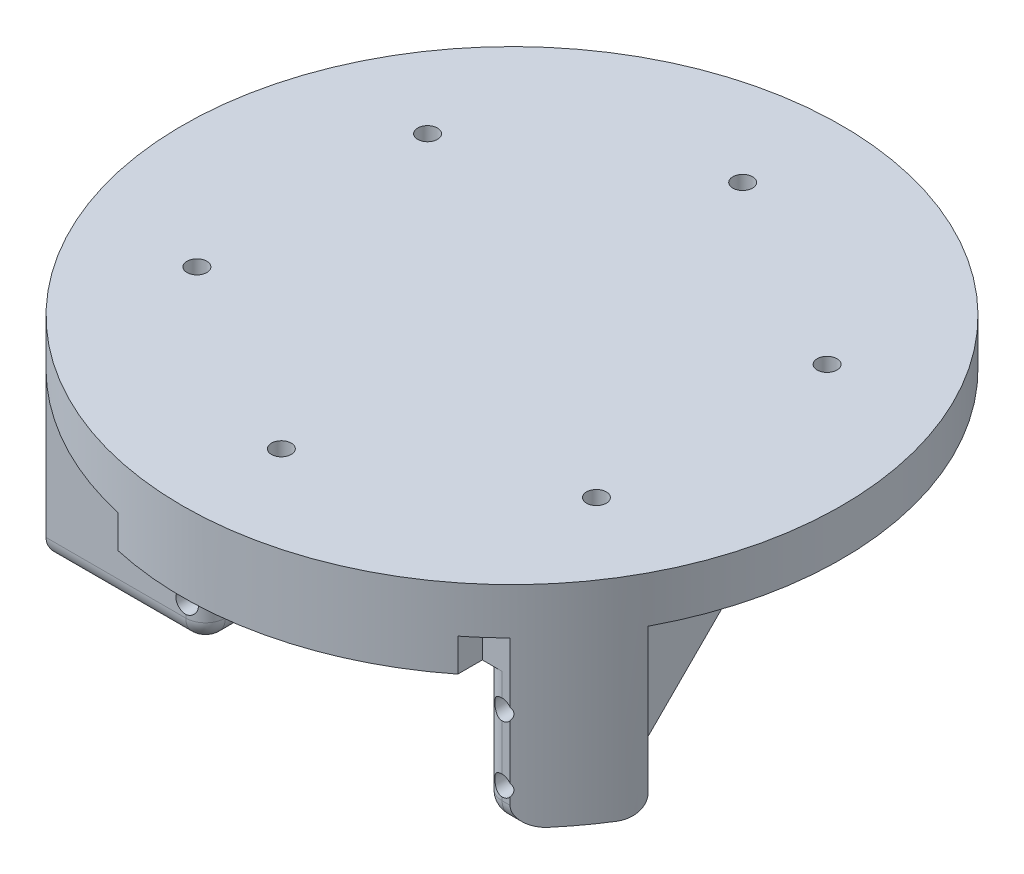
from build123d import *
from build123d.topology import SkipClean

# Parameters (mm, degrees)
SKETCH1_R            = 11.11
BOSS_EXTRUDE1_DEPTH  = 8
SKETCH2_R            = 50
SKETCH2_R_2          = 1.5
BOSS_EXTRUDE2_DEPTH  = 7
SKETCH13_R           = 22.569710477
CUT_EXTRUDE10_DEPTH  = 8
SKETCH3_R            = 4
CUT_EXTRUDE1_DEPTH   = 3
BOSS_EXTRUDE4_START  = 5
BOSS_EXTRUDE4_DEPTH  = 5
BOSS_EXTRUDE7_START  = 30
SKETCH5_6_R          = 4
BOSS_EXTRUDE7_DEPTH  = 30
SKETCH9_R            = 11.11
SKETCH9_R_2          = 4.25
CUT_EXTRUDE4_DEPTH   = 8
SKETCH9_2_R          = 4.25
CUT_EXTRUDE5_DEPTH   = 89.791891522
CUT_EXTRUDE6_START   = 30
SKETCH11_R           = 11
CUT_EXTRUDE6_DEPTH   = 9
CUT_EXTRUDE9_DEPTH   = 89.791891546
BOSS_EXTRUDE8_START  = 25
BOSS_EXTRUDE8_DEPTH  = 25
SKETCH14_3_W         = 6.5
SKETCH14_3_H         = 13.5
BOSS_EXTRUDE9_DEPTH  = 14.5
CHAMFER1_START       = 1
CHAMFER1_OUTLINE_W   = 6.5
CHAMFER1_OUTLINE_H   = 19.091883092
CHAMFER1_OUTLINE_W_2 = 9
CHAMFER1_DEPTH       = 11.02081528
SKETCH15_R           = 1.5
CUT_EXTRUDE11_DEPTH  = 21
FILLET1_START        = -18
FILLET1_DEPTH        = 21
FILLET2_R            = 3


with BuildPart() as part:
    # Sketch1 → Boss-Extrude1 (new body)
    with BuildSketch(Plane(origin=(0, 0, 0), x_dir=(1, 0, 0), z_dir=(0, 1, 0))):
        with BuildLine():
            Line((-0.88, 15.975781671), (-0.5, 17.975781671))
            Line((-0.5, 17.975781671), (0.5, 17.975781671))
            Line((0.5, 17.975781671), (0.88, 15.975781671))
            ThreePointArc((0.88, 15.975781671), (1.394491884, 15.939115169), (1.907534551, 15.885884046))
            Line((1.907534551, 15.885884046), (2.629057853, 17.789513245))
            Line((2.629057853, 17.789513245), (3.613865606, 17.615865067))
            Line((3.613865606, 17.615865067), (3.640796197, 15.580263254))
            ThreePointArc((3.640796197, 15.580263254), (4.141104722, 15.454813221), (4.637109631, 15.313301874))
            Line((4.637109631, 15.313301874), (5.678233113, 17.062719461))
            Line((5.678233113, 17.062719461), (6.617925734, 16.720699317))
            Line((6.617925734, 16.720699317), (6.290968643, 14.711346421))
            ThreePointArc((6.290968643, 14.711346421), (6.761892188, 14.500924593), (7.22578848, 14.275432772))
            Line((7.22578848, 14.275432772), (8.554878134, 15.81748358))
            Line((8.554878134, 15.81748358), (9.420903537, 15.31748358))
            Line((9.420903537, 15.31748358), (8.749993191, 13.395432772))
            ThreePointArc((8.749993191, 13.395432772), (9.177222982, 13.106432709), (9.594915403, 12.80381187))
            Line((9.594915403, 12.80381187), (11.171587511, 14.091641465))
            Line((11.171587511, 14.091641465), (11.937631954, 13.448853855))
            Line((11.937631954, 13.448853855), (10.943153623, 11.672505677))
            ThreePointArc((10.943153623, 11.672505677), (11.313708499, 11.313708499), (11.672505677, 10.943153623))
            Line((11.672505677, 10.943153623), (13.448853855, 11.937631954))
            Line((13.448853855, 11.937631954), (14.091641465, 11.171587511))
            Line((14.091641465, 11.171587511), (12.80381187, 9.594915403))
            ThreePointArc((12.80381187, 9.594915403), (13.106432709, 9.177222982), (13.395432772, 8.749993191))
            Line((13.395432772, 8.749993191), (15.31748358, 9.420903537))
            Line((15.31748358, 9.420903537), (15.81748358, 8.554878134))
            Line((15.81748358, 8.554878134), (14.275432772, 7.22578848))
            ThreePointArc((14.275432772, 7.22578848), (14.500924593, 6.761892188), (14.711346421, 6.290968643))
            Line((14.711346421, 6.290968643), (16.720699317, 6.617925734))
            Line((16.720699317, 6.617925734), (17.062719461, 5.678233113))
            Line((17.062719461, 5.678233113), (15.313301874, 4.637109631))
            ThreePointArc((15.313301874, 4.637109631), (15.454813221, 4.141104722), (15.580263254, 3.640796197))
            Line((15.580263254, 3.640796197), (17.615865067, 3.613865606))
            Line((17.615865067, 3.613865606), (17.789513245, 2.629057853))
            Line((17.789513245, 2.629057853), (15.885884046, 1.907534551))
            ThreePointArc((15.885884046, 1.907534551), (15.939115169, 1.394491884), (15.975781671, 0.88))
            Line((15.975781671, 0.88), (17.975781671, 0.5))
            Line((17.975781671, 0.5), (17.975781671, -0.5))
            Line((17.975781671, -0.5), (15.975781671, -0.88))
            ThreePointArc((15.975781671, -0.88), (15.939115169, -1.394491884), (15.885884046, -1.907534551))
            Line((15.885884046, -1.907534551), (17.789513245, -2.629057853))
            Line((17.789513245, -2.629057853), (17.615865067, -3.613865606))
            Line((17.615865067, -3.613865606), (15.580263254, -3.640796197))
            ThreePointArc((15.580263254, -3.640796197), (15.454813221, -4.141104722), (15.313301874, -4.637109631))
            Line((15.313301874, -4.637109631), (17.062719461, -5.678233113))
            Line((17.062719461, -5.678233113), (16.720699317, -6.617925734))
            Line((16.720699317, -6.617925734), (14.711346421, -6.290968643))
            ThreePointArc((14.711346421, -6.290968643), (14.500924593, -6.761892188), (14.275432772, -7.22578848))
            Line((14.275432772, -7.22578848), (15.81748358, -8.554878134))
            Line((15.81748358, -8.554878134), (15.31748358, -9.420903537))
            Line((15.31748358, -9.420903537), (13.395432772, -8.749993191))
            ThreePointArc((13.395432772, -8.749993191), (13.106432709, -9.177222982), (12.80381187, -9.594915403))
            Line((12.80381187, -9.594915403), (14.091641465, -11.171587511))
            Line((14.091641465, -11.171587511), (13.448853855, -11.937631954))
            Line((13.448853855, -11.937631954), (11.672505677, -10.943153623))
            ThreePointArc((11.672505677, -10.943153623), (11.313708499, -11.313708499), (10.943153623, -11.672505677))
            Line((10.943153623, -11.672505677), (11.937631954, -13.448853855))
            Line((11.937631954, -13.448853855), (11.171587511, -14.091641465))
            Line((11.171587511, -14.091641465), (9.594915403, -12.80381187))
            ThreePointArc((9.594915403, -12.80381187), (9.177222982, -13.106432709), (8.749993191, -13.395432772))
            Line((8.749993191, -13.395432772), (9.420903537, -15.31748358))
            Line((9.420903537, -15.31748358), (8.554878134, -15.81748358))
            Line((8.554878134, -15.81748358), (7.22578848, -14.275432772))
            ThreePointArc((7.22578848, -14.275432772), (6.761892188, -14.500924593), (6.290968643, -14.711346421))
            Line((6.290968643, -14.711346421), (6.617925734, -16.720699317))
            Line((6.617925734, -16.720699317), (5.678233113, -17.062719461))
            Line((5.678233113, -17.062719461), (4.637109631, -15.313301874))
            ThreePointArc((4.637109631, -15.313301874), (4.141104722, -15.454813221), (3.640796197, -15.580263254))
            Line((3.640796197, -15.580263254), (3.613865606, -17.615865067))
            Line((3.613865606, -17.615865067), (2.629057853, -17.789513245))
            Line((2.629057853, -17.789513245), (1.907534551, -15.885884046))
            ThreePointArc((1.907534551, -15.885884046), (1.394491884, -15.939115169), (0.88, -15.975781671))
            Line((0.88, -15.975781671), (0.5, -17.975781671))
            Line((0.5, -17.975781671), (-0.5, -17.975781671))
            Line((-0.5, -17.975781671), (-0.88, -15.975781671))
            ThreePointArc((-0.88, -15.975781671), (-1.394491884, -15.939115169), (-1.907534551, -15.885884046))
            Line((-1.907534551, -15.885884046), (-2.629057853, -17.789513245))
            Line((-2.629057853, -17.789513245), (-3.613865606, -17.615865067))
            Line((-3.613865606, -17.615865067), (-3.640796197, -15.580263254))
            ThreePointArc((-3.640796197, -15.580263254), (-4.141104722, -15.454813221), (-4.637109631, -15.313301874))
            Line((-4.637109631, -15.313301874), (-5.678233113, -17.062719461))
            Line((-5.678233113, -17.062719461), (-6.617925734, -16.720699317))
            Line((-6.617925734, -16.720699317), (-6.290968643, -14.711346421))
            ThreePointArc((-6.290968643, -14.711346421), (-6.761892188, -14.500924593), (-7.22578848, -14.275432772))
            Line((-7.22578848, -14.275432772), (-8.554878134, -15.81748358))
            Line((-8.554878134, -15.81748358), (-9.420903537, -15.31748358))
            Line((-9.420903537, -15.31748358), (-8.749993191, -13.395432772))
            ThreePointArc((-8.749993191, -13.395432772), (-9.177222982, -13.106432709), (-9.594915403, -12.80381187))
            Line((-9.594915403, -12.80381187), (-11.171587511, -14.091641465))
            Line((-11.171587511, -14.091641465), (-11.937631954, -13.448853855))
            Line((-11.937631954, -13.448853855), (-10.943153623, -11.672505677))
            ThreePointArc((-10.943153623, -11.672505677), (-11.313708499, -11.313708499), (-11.672505677, -10.943153623))
            Line((-11.672505677, -10.943153623), (-13.448853855, -11.937631954))
            Line((-13.448853855, -11.937631954), (-14.091641465, -11.171587511))
            Line((-14.091641465, -11.171587511), (-12.80381187, -9.594915403))
            ThreePointArc((-12.80381187, -9.594915403), (-13.106432709, -9.177222982), (-13.395432772, -8.749993191))
            Line((-13.395432772, -8.749993191), (-15.31748358, -9.420903537))
            Line((-15.31748358, -9.420903537), (-15.81748358, -8.554878134))
            Line((-15.81748358, -8.554878134), (-14.275432772, -7.22578848))
            ThreePointArc((-14.275432772, -7.22578848), (-14.500924593, -6.761892188), (-14.711346421, -6.290968643))
            Line((-14.711346421, -6.290968643), (-16.720699317, -6.617925734))
            Line((-16.720699317, -6.617925734), (-17.062719461, -5.678233113))
            Line((-17.062719461, -5.678233113), (-15.313301874, -4.637109631))
            ThreePointArc((-15.313301874, -4.637109631), (-15.454813221, -4.141104722), (-15.580263254, -3.640796197))
            Line((-15.580263254, -3.640796197), (-17.615865067, -3.613865606))
            Line((-17.615865067, -3.613865606), (-17.789513245, -2.629057853))
            Line((-17.789513245, -2.629057853), (-15.885884046, -1.907534551))
            ThreePointArc((-15.885884046, -1.907534551), (-15.939115169, -1.394491884), (-15.975781671, -0.88))
            Line((-15.975781671, -0.88), (-17.975781671, -0.5))
            Line((-17.975781671, -0.5), (-17.975781671, 0.5))
            Line((-17.975781671, 0.5), (-15.975781671, 0.88))
            ThreePointArc((-15.975781671, 0.88), (-15.939115169, 1.394491884), (-15.885884046, 1.907534551))
            Line((-15.885884046, 1.907534551), (-17.789513245, 2.629057853))
            Line((-17.789513245, 2.629057853), (-17.615865067, 3.613865606))
            Line((-17.615865067, 3.613865606), (-15.580263254, 3.640796197))
            ThreePointArc((-15.580263254, 3.640796197), (-15.454813221, 4.141104722), (-15.313301874, 4.637109631))
            Line((-15.313301874, 4.637109631), (-17.062719461, 5.678233113))
            Line((-17.062719461, 5.678233113), (-16.720699317, 6.617925734))
            Line((-16.720699317, 6.617925734), (-14.711346421, 6.290968643))
            ThreePointArc((-14.711346421, 6.290968643), (-14.500924593, 6.761892188), (-14.275432772, 7.22578848))
            Line((-14.275432772, 7.22578848), (-15.81748358, 8.554878134))
            Line((-15.81748358, 8.554878134), (-15.31748358, 9.420903537))
            Line((-15.31748358, 9.420903537), (-13.395432772, 8.749993191))
            ThreePointArc((-13.395432772, 8.749993191), (-13.106432709, 9.177222982), (-12.80381187, 9.594915403))
            Line((-12.80381187, 9.594915403), (-14.091641465, 11.171587511))
            Line((-14.091641465, 11.171587511), (-13.448853855, 11.937631954))
            Line((-13.448853855, 11.937631954), (-11.672505677, 10.943153623))
            ThreePointArc((-11.672505677, 10.943153623), (-11.313708499, 11.313708499), (-10.943153623, 11.672505677))
            Line((-10.943153623, 11.672505677), (-11.937631954, 13.448853855))
            Line((-11.937631954, 13.448853855), (-11.171587511, 14.091641465))
            Line((-11.171587511, 14.091641465), (-9.594915403, 12.80381187))
            ThreePointArc((-9.594915403, 12.80381187), (-9.177222982, 13.106432709), (-8.749993191, 13.395432772))
            Line((-8.749993191, 13.395432772), (-9.420903537, 15.31748358))
            Line((-9.420903537, 15.31748358), (-8.554878134, 15.81748358))
            Line((-8.554878134, 15.81748358), (-7.22578848, 14.275432772))
            ThreePointArc((-7.22578848, 14.275432772), (-6.761892188, 14.500924593), (-6.290968643, 14.711346421))
            Line((-6.290968643, 14.711346421), (-6.617925734, 16.720699317))
            Line((-6.617925734, 16.720699317), (-5.678233113, 17.062719461))
            Line((-5.678233113, 17.062719461), (-4.637109631, 15.313301874))
            ThreePointArc((-4.637109631, 15.313301874), (-4.141104722, 15.454813221), (-3.640796197, 15.580263254))
            Line((-3.640796197, 15.580263254), (-3.613865606, 17.615865067))
            Line((-3.613865606, 17.615865067), (-2.629057853, 17.789513245))
            Line((-2.629057853, 17.789513245), (-1.907534551, 15.885884046))
            ThreePointArc((-1.907534551, 15.885884046), (-1.394491884, 15.939115169), (-0.88, 15.975781671))
        make_face()
        with Locations(Location((0, 0, 0), (0, 0, 270))):
            Circle(SKETCH1_R, mode=Mode.SUBTRACT)
    extrude(amount=BOSS_EXTRUDE1_DEPTH)

    # Sketch2 → Boss-Extrude2 (add)
    with BuildSketch(Plane(origin=(0, 8, 0), x_dir=(1, 0, 0), z_dir=(0, 1, 0))):
        with Locations(Location((0, 0, 0), (0, 0, 270))):
            Circle(SKETCH2_R)
        with Locations(Location((0, 35, 0), (0, 0, 270))):
            Circle(SKETCH2_R_2, mode=Mode.SUBTRACT)
        with Locations(Location((30.310889132, 17.5, 0), (0, 0, 270))):
            Circle(SKETCH2_R_2, mode=Mode.SUBTRACT)
        with Locations(Location((30.310889132, -17.5, 0), (0, 0, 270))):
            Circle(SKETCH2_R_2, mode=Mode.SUBTRACT)
        with Locations(Location((0, -35, 0), (0, 0, 270))):
            Circle(SKETCH2_R_2, mode=Mode.SUBTRACT)
        with Locations(Location((-30.310889132, -17.5, 0), (0, 0, 270))):
            Circle(SKETCH2_R_2, mode=Mode.SUBTRACT)
        with Locations(Location((-30.310889132, 17.5, 0), (0, 0, 270))):
            Circle(SKETCH2_R_2, mode=Mode.SUBTRACT)
    extrude(amount=BOSS_EXTRUDE2_DEPTH)

    # Sketch13 → Cut-Extrude10 (cut)
    with BuildSketch(Plane.XZ):
        Circle(SKETCH13_R)
    extrude(amount=-CUT_EXTRUDE10_DEPTH, mode=Mode.SUBTRACT)

    # Sketch3 → Cut-Extrude1 (cut)
    with BuildSketch(Plane(origin=(0, 8, 0), x_dir=(-1, 0, 0), z_dir=(0, -1, 0))):
        with Locations(Location((0, -35, 0), (0, 0, 90))):
            Circle(SKETCH3_R)
        with Locations(Location((-30.310889132, -17.5, 0), (0, 0, 90))):
            Circle(SKETCH3_R)
        with Locations(Location((-30.310889132, 17.5, 0), (0, 0, 90))):
            Circle(SKETCH3_R)
        with Locations(Location((0, 35, 0), (0, 0, 90))):
            Circle(SKETCH3_R)
        with Locations(Location((30.310889132, 17.5, 0), (0, 0, 90))):
            Circle(SKETCH3_R)
        with Locations(Location((30.310889132, -17.5, 0), (0, 0, 90))):
            Circle(SKETCH3_R)
    extrude(amount=-CUT_EXTRUDE1_DEPTH, mode=Mode.SUBTRACT)

    # Whole damn part sketch → Boss-Extrude4 (add)
    with SkipClean():  # the faces are left unmerged after this step: merging them gives an invalid solid
        with BuildSketch(Plane.XZ.offset(-8).offset(BOSS_EXTRUDE4_START)):
            with BuildLine():
                Line((5.172514856, 10), (31, 10))
                Line((31, 10), (31, 13.559806323))
                ThreePointArc((31, 13.559806323), (26.310889132, 17.5), (31, 21.440193677))
                Line((31, 21.440193677), (31, 23.5))
                Line((31, 23.5), (31, 31.5))
                Line((31, 31.5), (31, 39.230090492))
                ThreePointArc((31, 39.230090492), (11.080446462, 48.75678113), (-11, 48.774993593))
                Line((-11, 48.774993593), (-11, 31.5))
                Line((-11, 31.5), (-11, 23.5))
                Line((-11, 23.5), (-11, 10))
                Line((-11, 10), (-3.637178261, 10))
                Line((-3.637178261, 10), (5.172514856, 10))
            make_face()
            with BuildLine():
                Line((25, 16), (-5, 16))
                Line((-5, 16), (-5, 44.307554426))
                ThreePointArc((-5, 44.307554426), (10.490427751, 43.538626155), (25, 38.05985661))
                Line((25, 38.05985661), (25, 16))
            make_face(mode=Mode.SUBTRACT)
        extrude(amount=-BOSS_EXTRUDE4_DEPTH)

    # Sketch5<6> → Boss-Extrude7 (add)
    with SkipClean():  # the faces are left unmerged after this step: merging them gives an invalid solid
        with BuildSketch(Plane.XZ.offset(-8).offset(BOSS_EXTRUDE7_START)):
            with BuildLine():
                Line((-15, -20), (-15, -47.696960071))
                ThreePointArc((-15, -47.696960071), (-7.587884964, -49.420886291), (0, -50))
                ThreePointArc((0, -50), (7.587884964, -49.420886291), (15, -47.696960071))
                Line((15, -47.696960071), (15, -20))
                Line((15, -20), (-15, -20))
            make_face()
            with Locations(Location((0, -35, 0), (0, 0, 270))):
                Circle(SKETCH5_6_R, mode=Mode.SUBTRACT)
        extrude(amount=-BOSS_EXTRUDE7_DEPTH)

    # Sketch9 → Cut-Extrude4 (cut)
    with SkipClean():  # the faces are left unmerged after this step: merging them gives an invalid solid
        with BuildSketch(Plane.XY.offset(-20)):
            with Locations((0, -7)):
                Circle(SKETCH9_R)
            with Locations((0, -7)):
                Circle(SKETCH9_R_2, mode=Mode.SUBTRACT)
        extrude(amount=-CUT_EXTRUDE4_DEPTH, mode=Mode.SUBTRACT)

    # Sketch9<2> → Cut-Extrude5 (cut, through all)
    with SkipClean():  # the faces are left unmerged after this step: merging them gives an invalid solid
        with BuildSketch(Plane.XY.offset(-20)):
            with Locations((0, -7)):
                Circle(SKETCH9_2_R)
        extrude(amount=-CUT_EXTRUDE5_DEPTH, mode=Mode.SUBTRACT)

    # Sketch11 → Cut-Extrude6 (cut)
    with SkipClean():  # the faces are left unmerged after this step: merging them gives an invalid solid
        with BuildSketch(Plane(origin=(0, 0, -20), x_dir=(-1, 0, 0), z_dir=(0, 0, -1)).offset(CUT_EXTRUDE6_START)):
            with Locations((0, -7)):
                Circle(SKETCH11_R)
        extrude(amount=-CUT_EXTRUDE6_DEPTH, mode=Mode.SUBTRACT)

    # Sketch12 → Cut-Extrude9 (cut, through all)
    with SkipClean():  # the faces are left unmerged after this step: merging them gives an invalid solid
        with BuildSketch(Plane.XY.offset(-20)):
            with BuildLine():
                ThreePointArc((0, -22), (-10.606601732, -17.606601704), (-15, -6.99999996))
                Line((-15, -6.99999996), (-15, -22))
                Line((-15, -22), (0, -22))
            make_face()
            with BuildLine():
                Line((15, -22), (15, -7))
                ThreePointArc((15, -7), (10.606601718, -17.606601718), (0, -22))
                Line((0, -22), (15, -22))
            make_face()
        extrude(amount=-CUT_EXTRUDE9_DEPTH, mode=Mode.SUBTRACT)

    # Sketch14 → Boss-Extrude8 (add)
    with SkipClean():  # the faces are left unmerged after this step: merging them gives an invalid solid
        with BuildSketch(Plane.XZ.offset(-8).offset(BOSS_EXTRUDE8_START)):
            with BuildLine():
                Line((-23.476060795, 23.5), (-11, 23.5))
                Line((-11, 23.5), (-11, 35.5))
                Line((-11, 35.5), (-35.210083783, 35.5))
                ThreePointArc((-35.210083783, 35.5), (-40.122860822, 29.835482893), (-44.133320745, 23.5))
                Line((-44.133320745, 23.5), (-35.210083783, 23.5))
                Line((-35.210083783, 23.5), (-35.133320745, 23.5))
                Line((-35.133320745, 23.5), (-23.476060795, 23.5))
            make_face()
            with BuildLine():
                Line((35.210083783, 35.5), (31, 35.5))
                Line((31, 35.5), (31, 23.5))
                Line((31, 23.5), (37.633320745, 23.5))
                Line((37.633320745, 23.5), (44.133320745, 23.5))
                ThreePointArc((44.133320745, 23.5), (40.122860822, 29.835482893), (35.210083783, 35.5))
            make_face()
        extrude(amount=-BOSS_EXTRUDE8_DEPTH)

    # Sketch14<3> → Boss-Extrude9 (add)
    with SkipClean():  # the faces are left unmerged after this step: merging them gives an invalid solid
        with BuildSketch(Plane.XZ.offset(-8)):
            Polygon((-35.133320745, 10), (-35.133320745, 23.5), (-35.210083783, 23.5), (-44.133320745, 23.5), (-44.133320745, 10), align=None)
            with Locations((40.883320745, 16.75)):
                Rectangle(SKETCH14_3_W, SKETCH14_3_H)
        extrude(amount=BOSS_EXTRUDE9_DEPTH)

    # Chamfer1: read off the stored shape, not the designer's step
    # Chamfer1 outline → Chamfer1 (cut)
    with SkipClean():  # the faces are left unmerged after this step: merging them gives an invalid solid
        with BuildSketch(Plane(origin=(0, 0, 0), x_dir=(1, 0, 0), z_dir=(0, 0.707106781186546, 0.707106781186549)).offset(CHAMFER1_START)):
            with Locations((40.883320745, -11.66726189)):
                Rectangle(CHAMFER1_OUTLINE_W, CHAMFER1_OUTLINE_H)
            with Locations((-39.633320745, -11.66726189)):
                Rectangle(CHAMFER1_OUTLINE_W_2, CHAMFER1_OUTLINE_H)
        extrude(amount=CHAMFER1_DEPTH, mode=Mode.SUBTRACT)

    # Sketch15 → Cut-Extrude11 (cut, symmetric)
    with SkipClean():  # the faces are left unmerged after this step: merging them gives an invalid solid
        with BuildSketch(Plane(origin=(0, 0, 23.5), x_dir=(-1, 0, 0), z_dir=(0, 0, -1))):
            with Locations((14, -2)):
                Circle(SKETCH15_R)
            with Locations((14, -12)):
                Circle(SKETCH15_R)
            with Locations(Location((-34, -2, 0), (0, 0, 216.223067522))):
                Circle(SKETCH15_R)
            with Locations(Location((-34, -12, 0), (0, 0, 216.223067522))):
                Circle(SKETCH15_R)
        extrude(amount=CUT_EXTRUDE11_DEPTH, both=True, mode=Mode.SUBTRACT)

    # Fillet1: read off the stored shape, not the designer's step
    # Fillet1 outline → Fillet1 (cut)
    with SkipClean():  # the faces are left unmerged after this step: merging them gives an invalid solid
        with BuildSketch(Plane(origin=(0, 0, 0), x_dir=(1, 0, 0), z_dir=(0, 1, 0)).offset(FILLET1_START)):
            with BuildLine():
                Line((31, -35.5), (34, -35.5))
                ThreePointArc((34, -35.5), (31.878679656, -34.621320344), (31, -32.5))
                Line((31, -32.5), (31, -35.5))
            make_face()
            with BuildLine():
                Line((31, -23.5), (31, -26.5))
                ThreePointArc((31, -26.5), (31.878679656, -24.378679656), (34, -23.5))
                Line((34, -23.5), (31, -23.5))
            make_face()
            with BuildLine():
                ThreePointArc((-14, -23.5), (-11.878679656, -24.378679656), (-11, -26.5))
                Line((-11, -26.5), (-11, -23.5))
                Line((-11, -23.5), (-14, -23.5))
            make_face()
            with BuildLine():
                ThreePointArc((-11, -32.5), (-11.878679656, -34.621320344), (-14, -35.5))
                Line((-14, -35.5), (-11, -35.5))
                Line((-11, -35.5), (-11, -32.5))
            make_face()
        extrude(amount=FILLET1_DEPTH, mode=Mode.SUBTRACT)

    # Fillet2
    fillet2_edges = [part.edges().sort_by_distance(p)[0] for p in [
        (34.605041891, -17, 35.5),
        (31.878679656, -17, 34.621320344),
        (31, -17, 29.5),
        (31.878679656, -17, 24.378679656),
        (-11.878679656, -17, 24.378679656),
        (-29.066660373, -17, 23.5),
        (-40.122860822, -17, 29.835482893),
        (-24.605041891, -17, 35.5),
        (-11.878679656, -17, 34.621320344),
        (-11, -17, 29.5),
        (39.066660373, -17, 23.5),
    ]]
    fillet(fillet2_edges, radius=FILLET2_R)


solid = part.part
